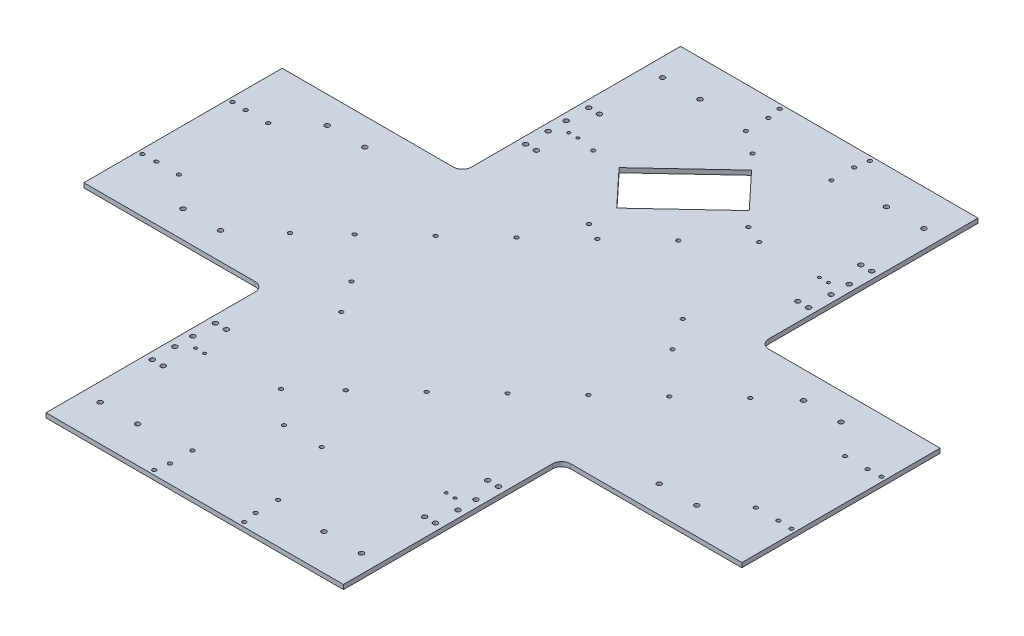
from build123d import *

# Parameters (mm, degrees)
BOSS_EXTRUDE1_DEPTH = 5
SKETCH2_R           = 2.125
CUT_EXTRUDE1_DEPTH  = 3
SKETCH4_R           = 2.6
SKETCH4_R_2         = 1.6
CUT_EXTRUDE3_DEPTH  = 10
SKETCH5_R           = 2.125
CUT_EXTRUDE4_DEPTH  = 10
FILLET1_R           = 10
SKETCH6_R           = 2.6
CUT_EXTRUDE5_DEPTH  = 10
SKETCH7_R           = 2.125
CUT_EXTRUDE6_DEPTH  = 10
SKETCH9_R           = 2.1
CUT_EXTRUDE7_DEPTH  = 10
SKETCH10_R          = 2.125
CUT_EXTRUDE8_DEPTH  = 10


with BuildPart() as part:
    # Sketch1 → Boss-Extrude1 (new body)
    with BuildSketch(Plane(origin=(0, 0, 0), x_dir=(1, 0, 0), z_dir=(0, 1, 0))):
        Polygon((165, 352), (-165, 352), (-165, 110), (-365, 110), (-365, -110), (-165, -110), (-165, -352), (165, -352), (165, -110), (365, -110), (365, 110), (165, 110), align=None)
    extrude(amount=BOSS_EXTRUDE1_DEPTH)

    # Sketch2 → Cut-Extrude1 (cut)
    with BuildSketch(Plane(origin=(0, 5, 0), x_dir=(1, 0, 0), z_dir=(0, 1, 0))):
        with Locations((345, 49.5)):
            Circle(SKETCH2_R)
        with Locations((320, 49.5)):
            Circle(SKETCH2_R)
        with Locations((320, -49.5)):
            Circle(SKETCH2_R)
        with Locations((345, -49.5)):
            Circle(SKETCH2_R)
        with Locations((-345, -49.5)):
            Circle(SKETCH2_R)
        with Locations((-320, -49.5)):
            Circle(SKETCH2_R)
        with Locations((-320, 49.5)):
            Circle(SKETCH2_R)
        with Locations((-345, 49.5)):
            Circle(SKETCH2_R)
        with Locations((47.5, 332)):
            Circle(SKETCH2_R)
        with Locations((47.5, 307)):
            Circle(SKETCH2_R)
        with Locations((-47.5, 307)):
            Circle(SKETCH2_R)
        with Locations((-47.5, 332)):
            Circle(SKETCH2_R)
        with Locations((-47.5, -332)):
            Circle(SKETCH2_R)
        with Locations((-47.5, -307)):
            Circle(SKETCH2_R)
        with Locations((47.5, -307)):
            Circle(SKETCH2_R)
        with Locations((47.5, -332)):
            Circle(SKETCH2_R)
    extrude(amount=-CUT_EXTRUDE1_DEPTH, mode=Mode.SUBTRACT)

    # Sketch4 → Cut-Extrude3 (cut)
    with BuildSketch(Plane(origin=(0, 5, 0), x_dir=(1, 0, 0), z_dir=(0, 1, 0))):
        with Locations((-157, 172)):
            Circle(SKETCH4_R)
        with Locations((-145, 172)):
            Circle(SKETCH4_R)
        with Locations((-157, 197)):
            Circle(SKETCH4_R)
        with Locations((-157, 217)):
            Circle(SKETCH4_R)
        with Locations((-157, 242)):
            Circle(SKETCH4_R)
        with Locations((-145, 242)):
            Circle(SKETCH4_R)
        with Locations((145, 242)):
            Circle(SKETCH4_R)
        with Locations((157, 242)):
            Circle(SKETCH4_R)
        with Locations((157, 217)):
            Circle(SKETCH4_R)
        with Locations((157, 197)):
            Circle(SKETCH4_R)
        with Locations((145, 172)):
            Circle(SKETCH4_R)
        with Locations((157, 172)):
            Circle(SKETCH4_R)
        with Locations((157, -172)):
            Circle(SKETCH4_R)
        with Locations((145, -172)):
            Circle(SKETCH4_R)
        with Locations((157, -197)):
            Circle(SKETCH4_R)
        with Locations((157, -217)):
            Circle(SKETCH4_R)
        with Locations((157, -242)):
            Circle(SKETCH4_R)
        with Locations((145, -242)):
            Circle(SKETCH4_R)
        with Locations((-145, -242)):
            Circle(SKETCH4_R)
        with Locations((-157, -242)):
            Circle(SKETCH4_R)
        with Locations((-157, -217)):
            Circle(SKETCH4_R)
        with Locations((-157, -197)):
            Circle(SKETCH4_R)
        with Locations((-145, -172)):
            Circle(SKETCH4_R)
        with Locations((-157, -172)):
            Circle(SKETCH4_R)
        with Locations((144, -207)):
            Circle(SKETCH4_R_2)
        with Locations((-144, -207)):
            Circle(SKETCH4_R_2)
        with Locations((144, 207)):
            Circle(SKETCH4_R_2)
        with Locations((-144, 207)):
            Circle(SKETCH4_R_2)
        with Locations((134, -207)):
            Circle(SKETCH4_R_2)
        with Locations((-134, -207)):
            Circle(SKETCH4_R_2)
        with Locations((134, 207)):
            Circle(SKETCH4_R_2)
        with Locations((-134, 207)):
            Circle(SKETCH4_R_2)
    extrude(amount=-CUT_EXTRUDE3_DEPTH, mode=Mode.SUBTRACT)

    # Sketch5 → Cut-Extrude4 (cut)
    with BuildSketch(Plane(origin=(0, 5, 0), x_dir=(1, 0, 0), z_dir=(0, 1, 0))):
        with Locations((-50, 347)):
            Circle(SKETCH5_R)
        with Locations((50, 347)):
            Circle(SKETCH5_R)
        with Locations((50, -347)):
            Circle(SKETCH5_R)
        with Locations((-50, -347)):
            Circle(SKETCH5_R)
        with Locations((-360, 50)):
            Circle(SKETCH5_R)
        with Locations((-360, -50)):
            Circle(SKETCH5_R)
        with Locations((360, -50)):
            Circle(SKETCH5_R)
        with Locations((360, 50)):
            Circle(SKETCH5_R)
    extrude(amount=-CUT_EXTRUDE4_DEPTH, mode=Mode.SUBTRACT)

    # Fillet1
    fillet1_edges = [part.edges().sort_by_distance(p)[0] for p in [
        (-165, 2.5, -110),
        (-165, 2.5, 110),
        (165, 2.5, 110),
        (165, 2.5, -110),
    ]]
    fillet(fillet1_edges, radius=FILLET1_R)

    # Sketch6 → Cut-Extrude5 (cut)
    with BuildSketch(Plane(origin=(0, 5, 0), x_dir=(1, 0, 0), z_dir=(0, 1, 0))):
        with Locations((-145, 312)):
            Circle(SKETCH6_R)
        with Locations((-103.4, 312)):
            Circle(SKETCH6_R)
        with Locations((103.4, 312)):
            Circle(SKETCH6_R)
        with Locations((145, 312)):
            Circle(SKETCH6_R)
        with Locations((145, -312)):
            Circle(SKETCH6_R)
        with Locations((103.4, -312)):
            Circle(SKETCH6_R)
        with Locations((-103.4, -312)):
            Circle(SKETCH6_R)
        with Locations((-145, -312)):
            Circle(SKETCH6_R)
        with Locations((243.4, 80)):
            Circle(SKETCH6_R)
        with Locations((285, 80)):
            Circle(SKETCH6_R)
        with Locations((285, -80)):
            Circle(SKETCH6_R)
        with Locations((243.4, -80)):
            Circle(SKETCH6_R)
        with Locations((-243.4, -80)):
            Circle(SKETCH6_R)
        with Locations((-285, -80)):
            Circle(SKETCH6_R)
        with Locations((-285, 80)):
            Circle(SKETCH6_R)
        with Locations((-243.4, 80)):
            Circle(SKETCH6_R)
    extrude(amount=-CUT_EXTRUDE5_DEPTH, mode=Mode.SUBTRACT)

    # Sketch7 → Cut-Extrude6 (cut)
    with BuildSketch(Plane(origin=(0, 5, 0), x_dir=(1, 0, 0), z_dir=(0, 1, 0))):
        with Locations((-72.423012394, 77.400951388)):
            Circle(SKETCH7_R)
        with Locations((-26.055461327, 120.786435228)):
            Circle(SKETCH7_R)
        with Locations((20.31208974, 164.171919068)):
            Circle(SKETCH7_R)
        with Locations((66.679640807, 207.557402908)):
            Circle(SKETCH7_R)
        with Locations((-118.790563461, 34.015467548)):
            Circle(SKETCH7_R)
        with Locations((-165.158114529, -9.370016292)):
            Circle(SKETCH7_R)
        with Locations((-202.252155383, -44.078403364)):
            Circle(SKETCH7_R)
        with Locations((-57.406130594, -198.88030614)):
            Circle(SKETCH7_R)
        with Locations((-20.31208974, -164.171919068)):
            Circle(SKETCH7_R)
        with Locations((26.055461327, -120.786435228)):
            Circle(SKETCH7_R)
        with Locations((211.525665596, 52.755500132)):
            Circle(SKETCH7_R)
        with Locations((165.158114529, 9.370016292)):
            Circle(SKETCH7_R)
        with Locations((118.790563461, -34.015467548)):
            Circle(SKETCH7_R)
        with Locations((72.423012394, -77.400951388)):
            Circle(SKETCH7_R)
    extrude(amount=-CUT_EXTRUDE6_DEPTH, mode=Mode.SUBTRACT)

    # Sketch9 → Cut-Extrude7 (cut)
    with BuildSketch(Plane(origin=(0, 5, 0), x_dir=(1, 0, 0), z_dir=(0, 1, 0))):
        with Locations((-121.560496485, -56.440276951)):
            Circle(SKETCH9_R)
        with Locations((-98.122996746, -91.292588295)):
            Circle(SKETCH9_R)
        with Locations((98.122996746, 91.292588295)):
            Circle(SKETCH9_R)
        with Locations((121.560496485, 56.440276951)):
            Circle(SKETCH9_R)
        with Locations((21, 232)):
            Circle(SKETCH9_R)
        with Locations((-21, 232)):
            Circle(SKETCH9_R)
        with Locations((-21, -232)):
            Circle(SKETCH9_R)
        with Locations((21, -232)):
            Circle(SKETCH9_R)
    extrude(amount=-CUT_EXTRUDE7_DEPTH, mode=Mode.SUBTRACT)

    # Sketch10 → Cut-Extrude8 (cut)
    with BuildSketch(Plane(origin=(0, 5, 0), x_dir=(1, 0, 0), z_dir=(0, 1, 0))):
        with Locations((46.274706825, 215.854629257)):
            Circle(SKETCH10_R)
        with Locations((-45, 130.450133509)):
            Circle(SKETCH10_R)
        with Locations((-113.323596598, 203.469898969)):
            Circle(SKETCH10_R)
        with Locations((-22.048889773, 288.874394717)):
            Circle(SKETCH10_R)
        Polygon((-6.676080538, 272.444947489), (30.901897591, 232.284076485), (-45.038658488, 161.227536023), (-82.616636617, 201.388407026), align=None)
    extrude(amount=-CUT_EXTRUDE8_DEPTH, mode=Mode.SUBTRACT)


solid = part.part
